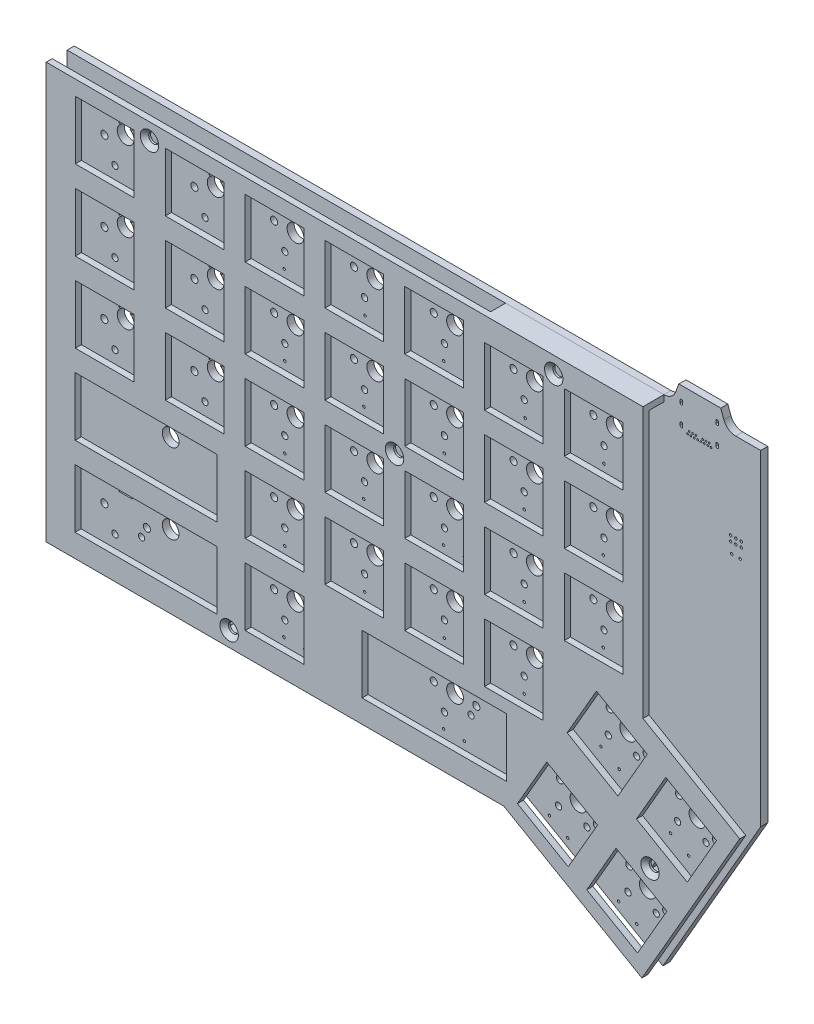
from build123d import *

# Parameters (mm, degrees)
BOSS_EXTRUDE1_START                            = -1.69143934
BOSS_EXTRUDE1_OUTLINE_R                        = 0.2999994
BOSS_EXTRUDE1_OUTLINE_R_2                      = 0.7499985
BOSS_EXTRUDE1_OUTLINE_R_3                      = 0.850000024
BOSS_EXTRUDE1_OUTLINE_R_4                      = 2
BOSS_EXTRUDE1_OUTLINE_W                        = 3.200004578
BOSS_EXTRUDE1_OUTLINE_H                        = 2.799999237
BOSS_EXTRUDE1_OUTLINE_W_2                      = 3.199996948
BOSS_EXTRUDE1_OUTLINE_H_2                      = 2.800003052
BOSS_EXTRUDE1_OUTLINE_W_3                      = 3.200000763
BOSS_EXTRUDE1_OUTLINE_W_4                      = 3.199999809
BOSS_EXTRUDE1_OUTLINE_H_3                      = 2.799995422
BOSS_EXTRUDE1_OUTLINE_R_5                      = 0.1999996
BOSS_EXTRUDE1_DEPTH                            = 1.69143934
SKETCH2_W                                      = 14
SKETCH2_H                                      = 14
BOSS_EXTRUDE2_DEPTH                            = 5.0038
CUT_EXTRUDE1_DEPTH                             = 3.556
SKETCH14_W                                     = 104.647420515
SKETCH14_H                                     = 1.5
SKETCH14_W_2                                   = 40.77646525
CUT_EXTRUDE6_DEPTH                             = 3.556
CSK_FOR_M2_FLAT_HEAD_MACHINE_SCREW1_AT_2_COUNT = 2
CSK_FOR_M2_FLAT_HEAD_MACHINE_SCREW1_AT_2_PITCH = 96.499998959
CSK_FOR_M2_FLAT_HEAD_MACHINE_SCREW1_AT_3_COUNT = 2
CSK_FOR_M2_FLAT_HEAD_MACHINE_SCREW1_AT_3_PITCH = 150.052698859
CSK_FOR_M2_FLAT_HEAD_MACHINE_SCREW1_AT_4_COUNT = 2
CSK_FOR_M2_FLAT_HEAD_MACHINE_SCREW1_AT_4_PITCH = 68.42879411
CSK_FOR_M2_FLAT_HEAD_MACHINE_SCREW1_AT_5_COUNT = 2
CSK_FOR_M2_FLAT_HEAD_MACHINE_SCREW1_AT_5_PITCH = 93.694270215


# Read off the part's stored shape, not the designer's step: Boss-Extrude1
with BuildPart() as part:
    # Boss-Extrude1 outline → Boss-Extrude1 (new body)
    with BuildSketch(Plane(origin=(0, 0, -1.69143934), x_dir=(-1, 0, 0), z_dir=(0, 0, -1)).offset(BOSS_EXTRUDE1_START)):
        with BuildLine():
            Line((-105.828579714, 28.936268203), (3.414418806, 28.936268203))
            Line((3.414418806, 28.936268203), (3.414418806, 128.136993408))
            Line((3.414418806, 128.136993408), (-139.057665021, 128.136993408))
            ThreePointArc((-139.057665021, 128.136993408), (-140.77192707, 128.675652414), (-141.869995117, 130.098007665))
            Line((-141.869995117, 130.098007665), (-142.623001099, 132.136993871))
            Line((-142.623001099, 132.136993871), (-152.623001099, 132.136993871))
            Line((-152.623001099, 132.136993871), (-153.37600708, 130.098007665))
            ThreePointArc((-153.37600708, 130.098007665), (-154.474075127, 128.675652414), (-156.188337176, 128.136993408))
            Line((-156.188337176, 128.136993408), (-162.162994385, 128.136993408))
            Line((-162.162994385, 128.136993408), (-162.162994385, 50.337001801))
            Line((-162.162994385, 50.337001801), (-138.81300354, 9.892999649))
            Line((-138.81300354, 9.892999649), (-105.828579714, 28.936268203))
        make_face()
        with Locations((-132.5650892, 15.4500072)):
            Circle(BOSS_EXTRUDE1_OUTLINE_R, mode=Mode.SUBTRACT)
        with Locations((-137.2306628, 19.99615)):
            Circle(BOSS_EXTRUDE1_OUTLINE_R_2, mode=Mode.SUBTRACT)
        with Locations((-139.600997925, 21.561000824)):
            Circle(BOSS_EXTRUDE1_OUTLINE_R_3, mode=Mode.SUBTRACT)
        with Locations((-135.201004028, 24.100999832)):
            Circle(BOSS_EXTRUDE1_OUTLINE_R_4, mode=Mode.SUBTRACT)
        with Locations((-128.234948, 17.9499768)):
            Circle(BOSS_EXTRUDE1_OUTLINE_R, mode=Mode.SUBTRACT)
        with Locations((-130.4614104, 20.9714592)):
            Circle(BOSS_EXTRUDE1_OUTLINE_R_2, mode=Mode.SUBTRACT)
        with Locations((-144.9650644, 35.749992)):
            Circle(BOSS_EXTRUDE1_OUTLINE_R, mode=Mode.SUBTRACT)
        Polygon((-137.315002441, 30.962999344), (-135.91521916, 28.537869719), (-138.687222333, 26.937871245), (-140.087005615, 29.36300087), align=None, mode=Mode.SUBTRACT)
        with Locations((-130.802001953, 26.641000748)):
            Circle(BOSS_EXTRUDE1_OUTLINE_R_3, mode=Mode.SUBTRACT)
        with Locations((-123.050003052, 31.108999252)):
            Circle(BOSS_EXTRUDE1_OUTLINE_R_3, mode=Mode.SUBTRACT)
        with Locations((-140.6349232, 38.2500124)):
            Circle(BOSS_EXTRUDE1_OUTLINE_R, mode=Mode.SUBTRACT)
        Polygon((-120.76499939, 40.511001587), (-119.364835204, 38.086092449), (-122.135838927, 36.48609016), (-123.536003113, 38.910999298), align=None, mode=Mode.SUBTRACT)
        with Locations((-116.065046, 24.9500136)):
            Circle(BOSS_EXTRUDE1_OUTLINE_R, mode=Mode.SUBTRACT)
        with Locations((-111.7349556, 27.4499832)):
            Circle(BOSS_EXTRUDE1_OUTLINE_R, mode=Mode.SUBTRACT)
        with Locations((-120.6798196, 29.5438576)):
            Circle(BOSS_EXTRUDE1_OUTLINE_R_2, mode=Mode.SUBTRACT)
        with Locations((-113.9105672, 30.5191668)):
            Circle(BOSS_EXTRUDE1_OUTLINE_R_2, mode=Mode.SUBTRACT)
        with Locations((-118.650001526, 33.64899826)):
            Circle(BOSS_EXTRUDE1_OUTLINE_R_4, mode=Mode.SUBTRACT)
        with Locations((-114.250999451, 36.188999176)):
            Circle(BOSS_EXTRUDE1_OUTLINE_R_3, mode=Mode.SUBTRACT)
        with Locations((-91.4347676, 32.7000108)):
            Circle(BOSS_EXTRUDE1_OUTLINE_R, mode=Mode.SUBTRACT)
        with Locations((-86.4347776, 32.7000108)):
            Circle(BOSS_EXTRUDE1_OUTLINE_R, mode=Mode.SUBTRACT)
        with Locations((-92.9947848, 38.8345172)):
            Circle(BOSS_EXTRUDE1_OUTLINE_R_2, mode=Mode.SUBTRACT)
        with Locations((-86.6447848, 36.2945172)):
            Circle(BOSS_EXTRUDE1_OUTLINE_R_2, mode=Mode.SUBTRACT)
        with Locations((-151.464996338, 42.130001068)):
            Circle(BOSS_EXTRUDE1_OUTLINE_R_3, mode=Mode.SUBTRACT)
        with Locations((-149.095206, 40.5649684)):
            Circle(BOSS_EXTRUDE1_OUTLINE_R_2, mode=Mode.SUBTRACT)
        with Locations((-142.3259536, 41.5402776)):
            Circle(BOSS_EXTRUDE1_OUTLINE_R_2, mode=Mode.SUBTRACT)
        with Locations((-147.065994263, 44.669998169)):
            Circle(BOSS_EXTRUDE1_OUTLINE_R_4, mode=Mode.SUBTRACT)
        with Locations((-142.666000366, 47.209999084)):
            Circle(BOSS_EXTRUDE1_OUTLINE_R_3, mode=Mode.SUBTRACT)
        Polygon((-149.179992676, 51.532001495), (-147.779833289, 49.107093991), (-150.550831546, 47.507099264), (-151.950990933, 49.932006768), align=None, mode=Mode.SUBTRACT)
        with Locations((-128.3650468, 45.3500236)):
            Circle(BOSS_EXTRUDE1_OUTLINE_R, mode=Mode.SUBTRACT)
        with Locations((-124.0349564, 47.8499932)):
            Circle(BOSS_EXTRUDE1_OUTLINE_R, mode=Mode.SUBTRACT)
        with Locations((-134.914001465, 51.678001404)):
            Circle(BOSS_EXTRUDE1_OUTLINE_R_3, mode=Mode.SUBTRACT)
        with Locations((-132.5443628, 50.11293)):
            Circle(BOSS_EXTRUDE1_OUTLINE_R_2, mode=Mode.SUBTRACT)
        with Locations((-125.7750596, 51.0882392)):
            Circle(BOSS_EXTRUDE1_OUTLINE_R_2, mode=Mode.SUBTRACT)
        with Locations((-130.51499939, 54.217998505)):
            Circle(BOSS_EXTRUDE1_OUTLINE_R_4, mode=Mode.SUBTRACT)
        Polygon((-132.628997803, 61.080001831), (-131.228832634, 58.655097666), (-133.999828727, 57.055095377), (-135.399993896, 59.479999542), align=None, mode=Mode.SUBTRACT)
        with Locations((-126.114997864, 56.75799942)):
            Circle(BOSS_EXTRUDE1_OUTLINE_R_3, mode=Mode.SUBTRACT)
        with Locations((-129.5827228, 68.6000152)):
            Circle(BOSS_EXTRUDE1_OUTLINE_R, mode=Mode.SUBTRACT)
        with Locations((-124.582682, 68.6000152)):
            Circle(BOSS_EXTRUDE1_OUTLINE_R, mode=Mode.SUBTRACT)
        with Locations((-110.7000072, 49.6000024)):
            Circle(BOSS_EXTRUDE1_OUTLINE_R, mode=Mode.SUBTRACT)
        with Locations((-105.7000172, 49.6000024)):
            Circle(BOSS_EXTRUDE1_OUTLINE_R, mode=Mode.SUBTRACT)
        with Locations((-105.6947848, 53.2750268)):
            Circle(BOSS_EXTRUDE1_OUTLINE_R_2, mode=Mode.SUBTRACT)
        with Locations((-94.26499939, 41.375)):
            Circle(BOSS_EXTRUDE1_OUTLINE_R_3, mode=Mode.SUBTRACT)
        with Locations((-89.184997559, 41.375)):
            Circle(BOSS_EXTRUDE1_OUTLINE_R_4, mode=Mode.SUBTRACT)
        with Locations((-84.105003357, 41.375)):
            Circle(BOSS_EXTRUDE1_OUTLINE_R_3, mode=Mode.SUBTRACT)
        with Locations((-89.185001373, 46.975000382)):
            Rectangle(BOSS_EXTRUDE1_OUTLINE_W, BOSS_EXTRUDE1_OUTLINE_H, mode=Mode.SUBTRACT)
        with Locations((-91.6447748, 51.5999984)):
            Circle(BOSS_EXTRUDE1_OUTLINE_R, mode=Mode.SUBTRACT)
        with Locations((-86.6447848, 51.5999984)):
            Circle(BOSS_EXTRUDE1_OUTLINE_R, mode=Mode.SUBTRACT)
        with Locations((-86.6447848, 55.3445172)):
            Circle(BOSS_EXTRUDE1_OUTLINE_R_2, mode=Mode.SUBTRACT)
        with Locations((-112.0447848, 55.8150268)):
            Circle(BOSS_EXTRUDE1_OUTLINE_R_2, mode=Mode.SUBTRACT)
        with Locations((-113.315002441, 58.354999542)):
            Circle(BOSS_EXTRUDE1_OUTLINE_R_3, mode=Mode.SUBTRACT)
        with Locations((-108.23500061, 58.354999542)):
            Circle(BOSS_EXTRUDE1_OUTLINE_R_4, mode=Mode.SUBTRACT)
        with Locations((-103.154998779, 58.354999542)):
            Circle(BOSS_EXTRUDE1_OUTLINE_R_3, mode=Mode.SUBTRACT)
        with Locations((-110.7000072, 68.6000152)):
            Circle(BOSS_EXTRUDE1_OUTLINE_R, mode=Mode.SUBTRACT)
        with Locations((-108.23500061, 63.955001831)):
            Rectangle(BOSS_EXTRUDE1_OUTLINE_W_2, BOSS_EXTRUDE1_OUTLINE_H_2, mode=Mode.SUBTRACT)
        with Locations((-105.7000172, 68.6000152)):
            Circle(BOSS_EXTRUDE1_OUTLINE_R, mode=Mode.SUBTRACT)
        with Locations((-92.9947848, 57.8845172)):
            Circle(BOSS_EXTRUDE1_OUTLINE_R_2, mode=Mode.SUBTRACT)
        with Locations((-94.26499939, 60.424999237)):
            Circle(BOSS_EXTRUDE1_OUTLINE_R_3, mode=Mode.SUBTRACT)
        with Locations((-89.184997559, 60.424999237)):
            Circle(BOSS_EXTRUDE1_OUTLINE_R_4, mode=Mode.SUBTRACT)
        with Locations((-84.105003357, 60.424999237)):
            Circle(BOSS_EXTRUDE1_OUTLINE_R_3, mode=Mode.SUBTRACT)
        with Locations((-91.4347676, 70.6999856)):
            Circle(BOSS_EXTRUDE1_OUTLINE_R, mode=Mode.SUBTRACT)
        with Locations((-89.185001373, 66.025001526)):
            Rectangle(BOSS_EXTRUDE1_OUTLINE_W, BOSS_EXTRUDE1_OUTLINE_H_2, mode=Mode.SUBTRACT)
        with Locations((-86.4347776, 70.6999856)):
            Circle(BOSS_EXTRUDE1_OUTLINE_R, mode=Mode.SUBTRACT)
        with Locations((-53.3347676, 32.5999856)):
            Circle(BOSS_EXTRUDE1_OUTLINE_R, mode=Mode.SUBTRACT)
        with Locations((-48.3347776, 32.5999856)):
            Circle(BOSS_EXTRUDE1_OUTLINE_R, mode=Mode.SUBTRACT)
        with Locations((-48.5447848, 36.2945172)):
            Circle(BOSS_EXTRUDE1_OUTLINE_R_2, mode=Mode.SUBTRACT)
        with Locations((-54.8947848, 38.8345172)):
            Circle(BOSS_EXTRUDE1_OUTLINE_R_2, mode=Mode.SUBTRACT)
        with Locations((-34.2847676, 30.100016)):
            Circle(BOSS_EXTRUDE1_OUTLINE_R, mode=Mode.SUBTRACT)
        with Locations((-29.2847776, 30.100016)):
            Circle(BOSS_EXTRUDE1_OUTLINE_R, mode=Mode.SUBTRACT)
        with Locations((-12.9947924, 30.100016)):
            Circle(BOSS_EXTRUDE1_OUTLINE_R, mode=Mode.SUBTRACT)
        with Locations((-7.9948024, 30.100016)):
            Circle(BOSS_EXTRUDE1_OUTLINE_R, mode=Mode.SUBTRACT)
        with Locations((-14.3448024, 36.3265212)):
            Circle(BOSS_EXTRUDE1_OUTLINE_R_2, mode=Mode.SUBTRACT)
        with Locations((-7.9948024, 33.7865212)):
            Circle(BOSS_EXTRUDE1_OUTLINE_R_2, mode=Mode.SUBTRACT)
        with Locations((-15.614999771, 38.86700058)):
            Circle(BOSS_EXTRUDE1_OUTLINE_R_3, mode=Mode.SUBTRACT)
        with Locations((-5.454999924, 38.86700058)):
            Circle(BOSS_EXTRUDE1_OUTLINE_R_3, mode=Mode.SUBTRACT)
        with Locations((-72.5947748, 51.5999984)):
            Circle(BOSS_EXTRUDE1_OUTLINE_R, mode=Mode.SUBTRACT)
        with Locations((-67.5947848, 51.5999984)):
            Circle(BOSS_EXTRUDE1_OUTLINE_R, mode=Mode.SUBTRACT)
        with Locations((-67.5947848, 55.3445172)):
            Circle(BOSS_EXTRUDE1_OUTLINE_R_2, mode=Mode.SUBTRACT)
        with Locations((-56.165000916, 41.375)):
            Circle(BOSS_EXTRUDE1_OUTLINE_R_3, mode=Mode.SUBTRACT)
        with Locations((-51.084999084, 41.375)):
            Circle(BOSS_EXTRUDE1_OUTLINE_R_4, mode=Mode.SUBTRACT)
        with Locations((-51.085000992, 46.975000382)):
            Rectangle(BOSS_EXTRUDE1_OUTLINE_W_3, BOSS_EXTRUDE1_OUTLINE_H, mode=Mode.SUBTRACT)
        with Locations((-46.005001068, 41.375)):
            Circle(BOSS_EXTRUDE1_OUTLINE_R_3, mode=Mode.SUBTRACT)
        with Locations((-53.542692, 51.5999984)):
            Circle(BOSS_EXTRUDE1_OUTLINE_R, mode=Mode.SUBTRACT)
        with Locations((-48.542702, 51.5999984)):
            Circle(BOSS_EXTRUDE1_OUTLINE_R, mode=Mode.SUBTRACT)
        with Locations((-48.5447848, 55.3445172)):
            Circle(BOSS_EXTRUDE1_OUTLINE_R_2, mode=Mode.SUBTRACT)
        with Locations((-73.9447848, 57.8845172)):
            Circle(BOSS_EXTRUDE1_OUTLINE_R_2, mode=Mode.SUBTRACT)
        with Locations((-75.214996338, 60.424999237)):
            Circle(BOSS_EXTRUDE1_OUTLINE_R_3, mode=Mode.SUBTRACT)
        with Locations((-70.135002136, 60.424999237)):
            Circle(BOSS_EXTRUDE1_OUTLINE_R_4, mode=Mode.SUBTRACT)
        with Locations((-65.055000305, 60.424999237)):
            Circle(BOSS_EXTRUDE1_OUTLINE_R_3, mode=Mode.SUBTRACT)
        with Locations((-70.135002136, 66.025001526)):
            Rectangle(BOSS_EXTRUDE1_OUTLINE_W_2, BOSS_EXTRUDE1_OUTLINE_H_2, mode=Mode.SUBTRACT)
        with Locations((-72.3847676, 70.6999856)):
            Circle(BOSS_EXTRUDE1_OUTLINE_R, mode=Mode.SUBTRACT)
        with Locations((-67.3847776, 70.6999856)):
            Circle(BOSS_EXTRUDE1_OUTLINE_R, mode=Mode.SUBTRACT)
        with Locations((-54.8947848, 57.8845172)):
            Circle(BOSS_EXTRUDE1_OUTLINE_R_2, mode=Mode.SUBTRACT)
        with Locations((-56.165000916, 60.424999237)):
            Circle(BOSS_EXTRUDE1_OUTLINE_R_3, mode=Mode.SUBTRACT)
        with Locations((-51.084999084, 60.424999237)):
            Circle(BOSS_EXTRUDE1_OUTLINE_R_4, mode=Mode.SUBTRACT)
        with Locations((-46.005001068, 60.424999237)):
            Circle(BOSS_EXTRUDE1_OUTLINE_R_3, mode=Mode.SUBTRACT)
        with Locations((-51.085000992, 66.025001526)):
            Rectangle(BOSS_EXTRUDE1_OUTLINE_W_3, BOSS_EXTRUDE1_OUTLINE_H_2, mode=Mode.SUBTRACT)
        with Locations((-53.542692, 70.6999856)):
            Circle(BOSS_EXTRUDE1_OUTLINE_R, mode=Mode.SUBTRACT)
        with Locations((-48.542702, 70.6999856)):
            Circle(BOSS_EXTRUDE1_OUTLINE_R, mode=Mode.SUBTRACT)
        with Locations((-21.284999847, 41.375)):
            Circle(BOSS_EXTRUDE1_OUTLINE_R_4, mode=Mode.SUBTRACT)
        with Locations((-34.4947748, 49.2000032)):
            Circle(BOSS_EXTRUDE1_OUTLINE_R, mode=Mode.SUBTRACT)
        with Locations((-29.4947848, 49.2000032)):
            Circle(BOSS_EXTRUDE1_OUTLINE_R, mode=Mode.SUBTRACT)
        with Locations((-10.535000325, 44.467000962)):
            Rectangle(BOSS_EXTRUDE1_OUTLINE_W_4, BOSS_EXTRUDE1_OUTLINE_H, mode=Mode.SUBTRACT)
        with Locations((-12.9947924, 49.2000032)):
            Circle(BOSS_EXTRUDE1_OUTLINE_R, mode=Mode.SUBTRACT)
        with Locations((-7.9948024, 49.2000032)):
            Circle(BOSS_EXTRUDE1_OUTLINE_R, mode=Mode.SUBTRACT)
        with Locations((-21.284999847, 60.424999237)):
            Circle(BOSS_EXTRUDE1_OUTLINE_R_4, mode=Mode.SUBTRACT)
        with Locations((-34.4947748, 68.200016)):
            Circle(BOSS_EXTRUDE1_OUTLINE_R, mode=Mode.SUBTRACT)
        with Locations((-29.4947848, 68.200016)):
            Circle(BOSS_EXTRUDE1_OUTLINE_R, mode=Mode.SUBTRACT)
        with Locations((-12.7847852, 68.200016)):
            Circle(BOSS_EXTRUDE1_OUTLINE_R, mode=Mode.SUBTRACT)
        with Locations((-7.7847952, 68.200016)):
            Circle(BOSS_EXTRUDE1_OUTLINE_R, mode=Mode.SUBTRACT)
        with Locations((-132.365005493, 77.404998779)):
            Circle(BOSS_EXTRUDE1_OUTLINE_R_3, mode=Mode.SUBTRACT)
        with Locations((-124.7447848, 72.3250268)):
            Circle(BOSS_EXTRUDE1_OUTLINE_R_2, mode=Mode.SUBTRACT)
        with Locations((-131.0947848, 74.8650268)):
            Circle(BOSS_EXTRUDE1_OUTLINE_R_2, mode=Mode.SUBTRACT)
        with Locations((-127.285003662, 77.404998779)):
            Circle(BOSS_EXTRUDE1_OUTLINE_R_4, mode=Mode.SUBTRACT)
        with Locations((-122.205001831, 77.404998779)):
            Circle(BOSS_EXTRUDE1_OUTLINE_R_3, mode=Mode.SUBTRACT)
        with Locations((-127.284996033, 83.005001068)):
            Rectangle(BOSS_EXTRUDE1_OUTLINE_W_2, BOSS_EXTRUDE1_OUTLINE_H_3, mode=Mode.SUBTRACT)
        with Locations((-129.5827228, 87.7000024)):
            Circle(BOSS_EXTRUDE1_OUTLINE_R, mode=Mode.SUBTRACT)
        with Locations((-124.582682, 87.7000024)):
            Circle(BOSS_EXTRUDE1_OUTLINE_R, mode=Mode.SUBTRACT)
        with Locations((-131.092702, 93.9152808)):
            Circle(BOSS_EXTRUDE1_OUTLINE_R_2, mode=Mode.SUBTRACT)
        with Locations((-124.742702, 91.3752808)):
            Circle(BOSS_EXTRUDE1_OUTLINE_R_2, mode=Mode.SUBTRACT)
        with Locations((-132.363006592, 96.455001831)):
            Circle(BOSS_EXTRUDE1_OUTLINE_R_3, mode=Mode.SUBTRACT)
        with Locations((-127.282997131, 96.455001831)):
            Circle(BOSS_EXTRUDE1_OUTLINE_R_4, mode=Mode.SUBTRACT)
        with Locations((-122.20300293, 96.455001831)):
            Circle(BOSS_EXTRUDE1_OUTLINE_R_3, mode=Mode.SUBTRACT)
        with Locations((-112.0447848, 74.8650268)):
            Circle(BOSS_EXTRUDE1_OUTLINE_R_2, mode=Mode.SUBTRACT)
        with Locations((-113.315002441, 77.404998779)):
            Circle(BOSS_EXTRUDE1_OUTLINE_R_3, mode=Mode.SUBTRACT)
        with Locations((-105.6947848, 72.3250268)):
            Circle(BOSS_EXTRUDE1_OUTLINE_R_2, mode=Mode.SUBTRACT)
        with Locations((-108.23500061, 77.404998779)):
            Circle(BOSS_EXTRUDE1_OUTLINE_R_4, mode=Mode.SUBTRACT)
        with Locations((-103.154998779, 77.404998779)):
            Circle(BOSS_EXTRUDE1_OUTLINE_R_3, mode=Mode.SUBTRACT)
        with Locations((-108.23500061, 83.005001068)):
            Rectangle(BOSS_EXTRUDE1_OUTLINE_W_2, BOSS_EXTRUDE1_OUTLINE_H_3, mode=Mode.SUBTRACT)
        with Locations((-92.9947848, 76.9345172)):
            Circle(BOSS_EXTRUDE1_OUTLINE_R_2, mode=Mode.SUBTRACT)
        with Locations((-86.6447848, 74.3945172)):
            Circle(BOSS_EXTRUDE1_OUTLINE_R_2, mode=Mode.SUBTRACT)
        with Locations((-94.26499939, 79.474998474)):
            Circle(BOSS_EXTRUDE1_OUTLINE_R_3, mode=Mode.SUBTRACT)
        with Locations((-89.184997559, 79.474998474)):
            Circle(BOSS_EXTRUDE1_OUTLINE_R_4, mode=Mode.SUBTRACT)
        with Locations((-84.105003357, 79.474998474)):
            Circle(BOSS_EXTRUDE1_OUTLINE_R_3, mode=Mode.SUBTRACT)
        with Locations((-89.185001373, 85.075000763)):
            Rectangle(BOSS_EXTRUDE1_OUTLINE_W, BOSS_EXTRUDE1_OUTLINE_H_3, mode=Mode.SUBTRACT)
        with Locations((-110.7000072, 87.7000024)):
            Circle(BOSS_EXTRUDE1_OUTLINE_R, mode=Mode.SUBTRACT)
        with Locations((-112.042702, 93.9152808)):
            Circle(BOSS_EXTRUDE1_OUTLINE_R_2, mode=Mode.SUBTRACT)
        with Locations((-105.7000172, 87.7000024)):
            Circle(BOSS_EXTRUDE1_OUTLINE_R, mode=Mode.SUBTRACT)
        with Locations((-105.692702, 91.3752808)):
            Circle(BOSS_EXTRUDE1_OUTLINE_R_2, mode=Mode.SUBTRACT)
        with Locations((-113.31300354, 96.455001831)):
            Circle(BOSS_EXTRUDE1_OUTLINE_R_3, mode=Mode.SUBTRACT)
        with Locations((-108.233001709, 96.455001831)):
            Circle(BOSS_EXTRUDE1_OUTLINE_R_4, mode=Mode.SUBTRACT)
        with Locations((-103.152999878, 96.455001831)):
            Circle(BOSS_EXTRUDE1_OUTLINE_R_3, mode=Mode.SUBTRACT)
        with Locations((-91.642692, 89.8000236)):
            Circle(BOSS_EXTRUDE1_OUTLINE_R, mode=Mode.SUBTRACT)
        with Locations((-86.642702, 89.8000236)):
            Circle(BOSS_EXTRUDE1_OUTLINE_R, mode=Mode.SUBTRACT)
        with Locations((-86.6447848, 93.4445172)):
            Circle(BOSS_EXTRUDE1_OUTLINE_R_2, mode=Mode.SUBTRACT)
        with Locations((-92.9947848, 95.9845172)):
            Circle(BOSS_EXTRUDE1_OUTLINE_R_2, mode=Mode.SUBTRACT)
        with Locations((-94.26499939, 98.525001526)):
            Circle(BOSS_EXTRUDE1_OUTLINE_R_3, mode=Mode.SUBTRACT)
        with Locations((-89.184997559, 98.525001526)):
            Circle(BOSS_EXTRUDE1_OUTLINE_R_4, mode=Mode.SUBTRACT)
        with Locations((-84.105003357, 98.525001526)):
            Circle(BOSS_EXTRUDE1_OUTLINE_R_3, mode=Mode.SUBTRACT)
        with Locations((-157.2500284, 103.249984)):
            Circle(BOSS_EXTRUDE1_OUTLINE_R, mode=Mode.SUBTRACT)
        with Locations((-155.2500324, 103.249984)):
            Circle(BOSS_EXTRUDE1_OUTLINE_R, mode=Mode.SUBTRACT)
        with Locations((-157.5000152, 105.7299892)):
            Circle(BOSS_EXTRUDE1_OUTLINE_R, mode=Mode.SUBTRACT)
        with Locations((-157.5000152, 106.9999892)):
            Circle(BOSS_EXTRUDE1_OUTLINE_R, mode=Mode.SUBTRACT)
        with Locations((-156.2300152, 105.7299892)):
            Circle(BOSS_EXTRUDE1_OUTLINE_R, mode=Mode.SUBTRACT)
        with Locations((-154.9600152, 105.7299892)):
            Circle(BOSS_EXTRUDE1_OUTLINE_R, mode=Mode.SUBTRACT)
        with Locations((-156.2300152, 106.9999892)):
            Circle(BOSS_EXTRUDE1_OUTLINE_R, mode=Mode.SUBTRACT)
        with Locations((-154.9600152, 106.9999892)):
            Circle(BOSS_EXTRUDE1_OUTLINE_R, mode=Mode.SUBTRACT)
        with Locations((-127.282997131, 102.055000305)):
            Rectangle(BOSS_EXTRUDE1_OUTLINE_W_2, BOSS_EXTRUDE1_OUTLINE_H_2, mode=Mode.SUBTRACT)
        with Locations((-129.742692, 106.7000152)):
            Circle(BOSS_EXTRUDE1_OUTLINE_R, mode=Mode.SUBTRACT)
        with Locations((-124.742702, 106.7000152)):
            Circle(BOSS_EXTRUDE1_OUTLINE_R, mode=Mode.SUBTRACT)
        with Locations((-132.363006592, 115.504997253)):
            Circle(BOSS_EXTRUDE1_OUTLINE_R_3, mode=Mode.SUBTRACT)
        with Locations((-131.092702, 112.9652808)):
            Circle(BOSS_EXTRUDE1_OUTLINE_R_2, mode=Mode.SUBTRACT)
        with Locations((-124.742702, 110.4252808)):
            Circle(BOSS_EXTRUDE1_OUTLINE_R_2, mode=Mode.SUBTRACT)
        with Locations((-127.282997131, 115.504997253)):
            Circle(BOSS_EXTRUDE1_OUTLINE_R_4, mode=Mode.SUBTRACT)
        with Locations((-122.20300293, 115.504997253)):
            Circle(BOSS_EXTRUDE1_OUTLINE_R_3, mode=Mode.SUBTRACT)
        with Locations((-150.2999788, 122.8200236)):
            Circle(BOSS_EXTRUDE1_OUTLINE_R_5, mode=Mode.SUBTRACT)
        with Locations((-149.4999804, 122.8200236)):
            Circle(BOSS_EXTRUDE1_OUTLINE_R_5, mode=Mode.SUBTRACT)
        with Locations((-149.8999796, 123.5199968)):
            Circle(BOSS_EXTRUDE1_OUTLINE_R_5, mode=Mode.SUBTRACT)
        with BuildLine():
            ThreePointArc((-151.469979, 123.6699838), (-151.7699784, 123.3699844), (-152.0699778, 123.6699838))
            Line((-152.0699778, 123.6699838), (-152.0699778, 124.2699826))
            ThreePointArc((-152.0699778, 124.2699826), (-151.7699784, 124.569982), (-151.469979, 124.2699826))
            Line((-151.469979, 124.2699826), (-151.469979, 123.6699838))
        make_face(mode=Mode.SUBTRACT)
        with Locations((-148.699982, 122.8200236)):
            Circle(BOSS_EXTRUDE1_OUTLINE_R_5, mode=Mode.SUBTRACT)
        with Locations((-149.0999812, 123.5199968)):
            Circle(BOSS_EXTRUDE1_OUTLINE_R_5, mode=Mode.SUBTRACT)
        with Locations((-148.2999828, 123.5199968)):
            Circle(BOSS_EXTRUDE1_OUTLINE_R_5, mode=Mode.SUBTRACT)
        with Locations((-147.8999836, 122.8200236)):
            Circle(BOSS_EXTRUDE1_OUTLINE_R_5, mode=Mode.SUBTRACT)
        with Locations((-147.0999852, 122.8200236)):
            Circle(BOSS_EXTRUDE1_OUTLINE_R_5, mode=Mode.SUBTRACT)
        with Locations((-146.699986, 123.5199968)):
            Circle(BOSS_EXTRUDE1_OUTLINE_R_5, mode=Mode.SUBTRACT)
        with Locations((-146.2999868, 122.8200236)):
            Circle(BOSS_EXTRUDE1_OUTLINE_R_5, mode=Mode.SUBTRACT)
        with Locations((-145.4999884, 122.8200236)):
            Circle(BOSS_EXTRUDE1_OUTLINE_R_5, mode=Mode.SUBTRACT)
        with Locations((-145.8999876, 123.5199968)):
            Circle(BOSS_EXTRUDE1_OUTLINE_R_5, mode=Mode.SUBTRACT)
        with Locations((-144.69999, 122.8200236)):
            Circle(BOSS_EXTRUDE1_OUTLINE_R_5, mode=Mode.SUBTRACT)
        with Locations((-145.0999892, 123.5199968)):
            Circle(BOSS_EXTRUDE1_OUTLINE_R_5, mode=Mode.SUBTRACT)
        with BuildLine():
            ThreePointArc((-142.929991, 123.6699838), (-143.2299904, 123.3699844), (-143.5299898, 123.6699838))
            Line((-143.5299898, 123.6699838), (-143.5299898, 124.2699826))
            ThreePointArc((-143.5299898, 124.2699826), (-143.2299904, 124.569982), (-142.929991, 124.2699826))
            Line((-142.929991, 124.2699826), (-142.929991, 123.6699838))
        make_face(mode=Mode.SUBTRACT)
        with BuildLine():
            ThreePointArc((-151.469979, 128.4000226), (-151.7699784, 128.1000232), (-152.0699778, 128.4000226))
            Line((-152.0699778, 128.4000226), (-152.0699778, 129.0000214))
            ThreePointArc((-152.0699778, 129.0000214), (-151.7699784, 129.3000208), (-151.469979, 129.0000214))
            Line((-151.469979, 129.0000214), (-151.469979, 128.4000226))
        make_face(mode=Mode.SUBTRACT)
        with BuildLine():
            ThreePointArc((-142.929991, 128.4000226), (-143.2299904, 128.1000232), (-143.5299898, 128.4000226))
            Line((-143.5299898, 128.4000226), (-143.5299898, 129.0000214))
            ThreePointArc((-143.5299898, 129.0000214), (-143.2299904, 129.3000208), (-142.929991, 129.0000214))
            Line((-142.929991, 129.0000214), (-142.929991, 128.4000226))
        make_face(mode=Mode.SUBTRACT)
        with Locations((-127.282997131, 121.104999542)):
            Rectangle(BOSS_EXTRUDE1_OUTLINE_W_2, BOSS_EXTRUDE1_OUTLINE_H_3, mode=Mode.SUBTRACT)
        with Locations((-110.932722, 106.7000152)):
            Circle(BOSS_EXTRUDE1_OUTLINE_R, mode=Mode.SUBTRACT)
        with Locations((-108.233001709, 102.055000305)):
            Rectangle(BOSS_EXTRUDE1_OUTLINE_W_2, BOSS_EXTRUDE1_OUTLINE_H_2, mode=Mode.SUBTRACT)
        with Locations((-105.9326812, 106.7000152)):
            Circle(BOSS_EXTRUDE1_OUTLINE_R, mode=Mode.SUBTRACT)
        with Locations((-112.042702, 112.9652808)):
            Circle(BOSS_EXTRUDE1_OUTLINE_R_2, mode=Mode.SUBTRACT)
        with Locations((-113.31300354, 115.504997253)):
            Circle(BOSS_EXTRUDE1_OUTLINE_R_3, mode=Mode.SUBTRACT)
        with Locations((-105.692702, 110.4252808)):
            Circle(BOSS_EXTRUDE1_OUTLINE_R_2, mode=Mode.SUBTRACT)
        with Locations((-108.233001709, 115.504997253)):
            Circle(BOSS_EXTRUDE1_OUTLINE_R_4, mode=Mode.SUBTRACT)
        with Locations((-103.152999878, 115.504997253)):
            Circle(BOSS_EXTRUDE1_OUTLINE_R_3, mode=Mode.SUBTRACT)
        with Locations((-91.4827228, 108.7999856)):
            Circle(BOSS_EXTRUDE1_OUTLINE_R, mode=Mode.SUBTRACT)
        with Locations((-89.185001373, 104.125)):
            Rectangle(BOSS_EXTRUDE1_OUTLINE_W, BOSS_EXTRUDE1_OUTLINE_H_2, mode=Mode.SUBTRACT)
        with Locations((-86.482682, 108.7999856)):
            Circle(BOSS_EXTRUDE1_OUTLINE_R, mode=Mode.SUBTRACT)
        with Locations((-92.992702, 115.0347712)):
            Circle(BOSS_EXTRUDE1_OUTLINE_R_2, mode=Mode.SUBTRACT)
        with Locations((-86.642702, 112.4947712)):
            Circle(BOSS_EXTRUDE1_OUTLINE_R_2, mode=Mode.SUBTRACT)
        with Locations((-108.233001709, 121.104999542)):
            Rectangle(BOSS_EXTRUDE1_OUTLINE_W_2, BOSS_EXTRUDE1_OUTLINE_H_3, mode=Mode.SUBTRACT)
        with Locations((-94.263000488, 117.574996948)):
            Circle(BOSS_EXTRUDE1_OUTLINE_R_3, mode=Mode.SUBTRACT)
        with Locations((-89.182998657, 117.574996948)):
            Circle(BOSS_EXTRUDE1_OUTLINE_R_4, mode=Mode.SUBTRACT)
        with Locations((-84.102996826, 117.574996948)):
            Circle(BOSS_EXTRUDE1_OUTLINE_R_3, mode=Mode.SUBTRACT)
        with Locations((-89.182998657, 123.174999237)):
            Rectangle(BOSS_EXTRUDE1_OUTLINE_W_2, BOSS_EXTRUDE1_OUTLINE_H_3, mode=Mode.SUBTRACT)
        with Locations((-73.9447848, 76.9345172)):
            Circle(BOSS_EXTRUDE1_OUTLINE_R_2, mode=Mode.SUBTRACT)
        with Locations((-67.5947848, 74.3945172)):
            Circle(BOSS_EXTRUDE1_OUTLINE_R_2, mode=Mode.SUBTRACT)
        with Locations((-75.214996338, 79.474998474)):
            Circle(BOSS_EXTRUDE1_OUTLINE_R_3, mode=Mode.SUBTRACT)
        with Locations((-70.135002136, 79.474998474)):
            Circle(BOSS_EXTRUDE1_OUTLINE_R_4, mode=Mode.SUBTRACT)
        with Locations((-70.135002136, 85.075000763)):
            Rectangle(BOSS_EXTRUDE1_OUTLINE_W_2, BOSS_EXTRUDE1_OUTLINE_H_3, mode=Mode.SUBTRACT)
        with Locations((-65.055000305, 79.474998474)):
            Circle(BOSS_EXTRUDE1_OUTLINE_R_3, mode=Mode.SUBTRACT)
        with Locations((-48.5447848, 74.3945172)):
            Circle(BOSS_EXTRUDE1_OUTLINE_R_2, mode=Mode.SUBTRACT)
        with Locations((-54.8947848, 76.9345172)):
            Circle(BOSS_EXTRUDE1_OUTLINE_R_2, mode=Mode.SUBTRACT)
        with Locations((-56.165000916, 79.474998474)):
            Circle(BOSS_EXTRUDE1_OUTLINE_R_3, mode=Mode.SUBTRACT)
        with Locations((-51.084999084, 79.474998474)):
            Circle(BOSS_EXTRUDE1_OUTLINE_R_4, mode=Mode.SUBTRACT)
        with Locations((-51.085000992, 85.075000763)):
            Rectangle(BOSS_EXTRUDE1_OUTLINE_W_3, BOSS_EXTRUDE1_OUTLINE_H_3, mode=Mode.SUBTRACT)
        with Locations((-46.005001068, 79.474998474)):
            Circle(BOSS_EXTRUDE1_OUTLINE_R_3, mode=Mode.SUBTRACT)
        with Locations((-72.4348056, 89.8000236)):
            Circle(BOSS_EXTRUDE1_OUTLINE_R, mode=Mode.SUBTRACT)
        with Locations((-67.4347648, 89.8000236)):
            Circle(BOSS_EXTRUDE1_OUTLINE_R, mode=Mode.SUBTRACT)
        with Locations((-67.5947848, 93.4445172)):
            Circle(BOSS_EXTRUDE1_OUTLINE_R_2, mode=Mode.SUBTRACT)
        with Locations((-73.9447848, 95.9845172)):
            Circle(BOSS_EXTRUDE1_OUTLINE_R_2, mode=Mode.SUBTRACT)
        with Locations((-75.214996338, 98.525001526)):
            Circle(BOSS_EXTRUDE1_OUTLINE_R_3, mode=Mode.SUBTRACT)
        with Locations((-70.135002136, 98.525001526)):
            Circle(BOSS_EXTRUDE1_OUTLINE_R_4, mode=Mode.SUBTRACT)
        with Locations((-65.055000305, 98.525001526)):
            Circle(BOSS_EXTRUDE1_OUTLINE_R_3, mode=Mode.SUBTRACT)
        with Locations((-53.542692, 89.8000236)):
            Circle(BOSS_EXTRUDE1_OUTLINE_R, mode=Mode.SUBTRACT)
        with Locations((-48.542702, 89.8000236)):
            Circle(BOSS_EXTRUDE1_OUTLINE_R, mode=Mode.SUBTRACT)
        with Locations((-48.5447848, 93.4445172)):
            Circle(BOSS_EXTRUDE1_OUTLINE_R_2, mode=Mode.SUBTRACT)
        with Locations((-54.8947848, 95.9845172)):
            Circle(BOSS_EXTRUDE1_OUTLINE_R_2, mode=Mode.SUBTRACT)
        with Locations((-56.165000916, 98.525001526)):
            Circle(BOSS_EXTRUDE1_OUTLINE_R_3, mode=Mode.SUBTRACT)
        with Locations((-51.084999084, 98.525001526)):
            Circle(BOSS_EXTRUDE1_OUTLINE_R_4, mode=Mode.SUBTRACT)
        with Locations((-46.005001068, 98.525001526)):
            Circle(BOSS_EXTRUDE1_OUTLINE_R_3, mode=Mode.SUBTRACT)
        with Locations((-35.8447848, 74.4265212)):
            Circle(BOSS_EXTRUDE1_OUTLINE_R_2, mode=Mode.SUBTRACT)
        with Locations((-29.4947848, 71.8865212)):
            Circle(BOSS_EXTRUDE1_OUTLINE_R_2, mode=Mode.SUBTRACT)
        with Locations((-37.115001678, 76.967002869)):
            Circle(BOSS_EXTRUDE1_OUTLINE_R_3, mode=Mode.SUBTRACT)
        with Locations((-26.954999924, 76.967002869)):
            Circle(BOSS_EXTRUDE1_OUTLINE_R_3, mode=Mode.SUBTRACT)
        with BuildLine():
            Line((-30.434999466, 81.166999817), (-30.968636187, 81.166999817))
            ThreePointArc((-30.968636187, 81.166999817), (-32.034999847, 77.474998474), (-33.101363508, 81.166999817))
            Line((-33.101363508, 81.166999817), (-33.634998322, 81.166999817))
            Line((-33.634998322, 81.166999817), (-33.634998322, 83.967002869))
            Line((-33.634998322, 83.967002869), (-30.434999466, 83.967002869))
            Line((-30.434999466, 83.967002869), (-30.434999466, 81.166999817))
        make_face(mode=Mode.SUBTRACT)
        with Locations((-14.3448024, 74.4265212)):
            Circle(BOSS_EXTRUDE1_OUTLINE_R_2, mode=Mode.SUBTRACT)
        with Locations((-7.9948024, 71.8865212)):
            Circle(BOSS_EXTRUDE1_OUTLINE_R_2, mode=Mode.SUBTRACT)
        with Locations((-15.614999771, 76.967002869)):
            Circle(BOSS_EXTRUDE1_OUTLINE_R_3, mode=Mode.SUBTRACT)
        with Locations((-5.454999924, 76.967002869)):
            Circle(BOSS_EXTRUDE1_OUTLINE_R_3, mode=Mode.SUBTRACT)
        with BuildLine():
            Line((-8.93500042, 81.166999817), (-9.468636187, 81.166999817))
            ThreePointArc((-9.468636187, 81.166999817), (-10.534999847, 77.474998474), (-11.601363508, 81.166999817))
            Line((-11.601363508, 81.166999817), (-12.135000229, 81.166999817))
            Line((-12.135000229, 81.166999817), (-12.135000229, 83.967002869))
            Line((-12.135000229, 83.967002869), (-8.93500042, 83.967002869))
            Line((-8.93500042, 83.967002869), (-8.93500042, 81.166999817))
        make_face(mode=Mode.SUBTRACT)
        with Locations((-34.4947748, 87.3000032)):
            Circle(BOSS_EXTRUDE1_OUTLINE_R, mode=Mode.SUBTRACT)
        with Locations((-29.4947848, 87.3000032)):
            Circle(BOSS_EXTRUDE1_OUTLINE_R, mode=Mode.SUBTRACT)
        with Locations((-35.8447848, 93.4765212)):
            Circle(BOSS_EXTRUDE1_OUTLINE_R_2, mode=Mode.SUBTRACT)
        with Locations((-29.4947848, 90.9365212)):
            Circle(BOSS_EXTRUDE1_OUTLINE_R_2, mode=Mode.SUBTRACT)
        with Locations((-37.115001678, 96.016998291)):
            Circle(BOSS_EXTRUDE1_OUTLINE_R_3, mode=Mode.SUBTRACT)
        with BuildLine():
            Line((-30.434999466, 100.217002869), (-30.968636187, 100.217002869))
            ThreePointArc((-30.968636187, 100.217002869), (-32.034999847, 96.525001526), (-33.101363508, 100.217002869))
            Line((-33.101363508, 100.217002869), (-33.634998322, 100.217002869))
            Line((-33.634998322, 100.217002869), (-33.634998322, 103.016998291))
            Line((-33.634998322, 103.016998291), (-30.434999466, 103.016998291))
            Line((-30.434999466, 103.016998291), (-30.434999466, 100.217002869))
        make_face(mode=Mode.SUBTRACT)
        with Locations((-26.954999924, 96.016998291)):
            Circle(BOSS_EXTRUDE1_OUTLINE_R_3, mode=Mode.SUBTRACT)
        with Locations((-12.8347724, 87.3000032)):
            Circle(BOSS_EXTRUDE1_OUTLINE_R, mode=Mode.SUBTRACT)
        with Locations((-7.8347824, 87.3000032)):
            Circle(BOSS_EXTRUDE1_OUTLINE_R, mode=Mode.SUBTRACT)
        with Locations((-14.3448024, 93.4765212)):
            Circle(BOSS_EXTRUDE1_OUTLINE_R_2, mode=Mode.SUBTRACT)
        with Locations((-7.9948024, 90.9365212)):
            Circle(BOSS_EXTRUDE1_OUTLINE_R_2, mode=Mode.SUBTRACT)
        with Locations((-15.614999771, 96.016998291)):
            Circle(BOSS_EXTRUDE1_OUTLINE_R_3, mode=Mode.SUBTRACT)
        with BuildLine():
            ThreePointArc((-9.468636187, 100.217002869), (-10.534999847, 96.525001526), (-11.601363508, 100.217002869))
            Line((-11.601363508, 100.217002869), (-12.135000229, 100.217002869))
            Line((-12.135000229, 100.217002869), (-12.135000229, 103.016998291))
            Line((-12.135000229, 103.016998291), (-8.93500042, 103.016998291))
            Line((-8.93500042, 103.016998291), (-8.93500042, 100.217002869))
            Line((-8.93500042, 100.217002869), (-9.468636187, 100.217002869))
        make_face(mode=Mode.SUBTRACT)
        with Locations((-5.454999924, 96.016998291)):
            Circle(BOSS_EXTRUDE1_OUTLINE_R_3, mode=Mode.SUBTRACT)
        with Locations((-70.135002136, 104.125)):
            Rectangle(BOSS_EXTRUDE1_OUTLINE_W_2, BOSS_EXTRUDE1_OUTLINE_H_2, mode=Mode.SUBTRACT)
        with Locations((-72.6999816, 108.7999856)):
            Circle(BOSS_EXTRUDE1_OUTLINE_R, mode=Mode.SUBTRACT)
        with Locations((-67.6999916, 108.7999856)):
            Circle(BOSS_EXTRUDE1_OUTLINE_R, mode=Mode.SUBTRACT)
        with Locations((-73.942702, 115.0347712)):
            Circle(BOSS_EXTRUDE1_OUTLINE_R_2, mode=Mode.SUBTRACT)
        with Locations((-67.592702, 112.4947712)):
            Circle(BOSS_EXTRUDE1_OUTLINE_R_2, mode=Mode.SUBTRACT)
        with Locations((-51.085000992, 104.125)):
            Rectangle(BOSS_EXTRUDE1_OUTLINE_W_3, BOSS_EXTRUDE1_OUTLINE_H_2, mode=Mode.SUBTRACT)
        with Locations((-53.3827228, 108.7999856)):
            Circle(BOSS_EXTRUDE1_OUTLINE_R, mode=Mode.SUBTRACT)
        with Locations((-48.382682, 108.7999856)):
            Circle(BOSS_EXTRUDE1_OUTLINE_R, mode=Mode.SUBTRACT)
        with Locations((-48.542702, 112.4947712)):
            Circle(BOSS_EXTRUDE1_OUTLINE_R_2, mode=Mode.SUBTRACT)
        with Locations((-54.892702, 115.0347712)):
            Circle(BOSS_EXTRUDE1_OUTLINE_R_2, mode=Mode.SUBTRACT)
        with Locations((-75.212997437, 117.574996948)):
            Circle(BOSS_EXTRUDE1_OUTLINE_R_3, mode=Mode.SUBTRACT)
        with Locations((-70.133003235, 117.574996948)):
            Circle(BOSS_EXTRUDE1_OUTLINE_R_4, mode=Mode.SUBTRACT)
        with Locations((-70.13299942, 123.174999237)):
            Rectangle(BOSS_EXTRUDE1_OUTLINE_W, BOSS_EXTRUDE1_OUTLINE_H_3, mode=Mode.SUBTRACT)
        with Locations((-65.053001404, 117.574996948)):
            Circle(BOSS_EXTRUDE1_OUTLINE_R_3, mode=Mode.SUBTRACT)
        with Locations((-56.162998199, 117.574996948)):
            Circle(BOSS_EXTRUDE1_OUTLINE_R_3, mode=Mode.SUBTRACT)
        with Locations((-51.083000183, 117.574996948)):
            Circle(BOSS_EXTRUDE1_OUTLINE_R_4, mode=Mode.SUBTRACT)
        with Locations((-51.083000183, 123.174999237)):
            Rectangle(BOSS_EXTRUDE1_OUTLINE_W_2, BOSS_EXTRUDE1_OUTLINE_H_3, mode=Mode.SUBTRACT)
        with Locations((-46.002998352, 117.574996948)):
            Circle(BOSS_EXTRUDE1_OUTLINE_R_3, mode=Mode.SUBTRACT)
        with Locations((-34.492692, 106.300016)):
            Circle(BOSS_EXTRUDE1_OUTLINE_R, mode=Mode.SUBTRACT)
        with Locations((-29.492702, 106.300016)):
            Circle(BOSS_EXTRUDE1_OUTLINE_R, mode=Mode.SUBTRACT)
        with Locations((-35.842702, 112.5267752)):
            Circle(BOSS_EXTRUDE1_OUTLINE_R_2, mode=Mode.SUBTRACT)
        with Locations((-29.492702, 109.9867752)):
            Circle(BOSS_EXTRUDE1_OUTLINE_R_2, mode=Mode.SUBTRACT)
        with Locations((-37.112998962, 115.067001343)):
            Circle(BOSS_EXTRUDE1_OUTLINE_R_3, mode=Mode.SUBTRACT)
        with Locations((-26.952999115, 115.067001343)):
            Circle(BOSS_EXTRUDE1_OUTLINE_R_3, mode=Mode.SUBTRACT)
        with Locations((-12.8326896, 106.300016)):
            Circle(BOSS_EXTRUDE1_OUTLINE_R, mode=Mode.SUBTRACT)
        with Locations((-7.8326996, 106.300016)):
            Circle(BOSS_EXTRUDE1_OUTLINE_R, mode=Mode.SUBTRACT)
        with Locations((-14.3427196, 112.5267752)):
            Circle(BOSS_EXTRUDE1_OUTLINE_R_2, mode=Mode.SUBTRACT)
        with Locations((-7.9927196, 109.9867752)):
            Circle(BOSS_EXTRUDE1_OUTLINE_R_2, mode=Mode.SUBTRACT)
        with Locations((-15.612999916, 115.067001343)):
            Circle(BOSS_EXTRUDE1_OUTLINE_R_3, mode=Mode.SUBTRACT)
        with Locations((-5.453000069, 115.067001343)):
            Circle(BOSS_EXTRUDE1_OUTLINE_R_3, mode=Mode.SUBTRACT)
        with BuildLine():
            Line((-30.433000565, 119.266998291), (-30.968636187, 119.266998291))
            ThreePointArc((-30.968636187, 119.266998291), (-32.034999847, 115.574996948), (-33.101363508, 119.266998291))
            Line((-33.101363508, 119.266998291), (-33.63299942, 119.266998291))
            Line((-33.63299942, 119.266998291), (-33.63299942, 122.067001343))
            Line((-33.63299942, 122.067001343), (-30.433000565, 122.067001343))
            Line((-30.433000565, 122.067001343), (-30.433000565, 119.266998291))
        make_face(mode=Mode.SUBTRACT)
        with BuildLine():
            ThreePointArc((-9.468636187, 119.266998291), (-10.534999847, 115.574996948), (-11.601363508, 119.266998291))
            Line((-11.601363508, 119.266998291), (-12.133000374, 119.266998291))
            Line((-12.133000374, 119.266998291), (-12.133000374, 122.067001343))
            Line((-12.133000374, 122.067001343), (-8.932999611, 122.067001343))
            Line((-8.932999611, 122.067001343), (-8.932999611, 119.266998291))
            Line((-8.932999611, 119.266998291), (-9.468636187, 119.266998291))
        make_face(mode=Mode.SUBTRACT)
    extrude(amount=BOSS_EXTRUDE1_DEPTH)


with BuildPart() as body_2:
    # Sketch2 → Boss-Extrude2 (new body)
    with BuildSketch(Plane.XY):
        Polygon((139.057665021, 128.136993408), (-3.414418806, 128.136993408), (-3.414418806, 28.936268203), (105.828579714, 28.936268203), (138.81300354, 9.892999649), (162.162994385, 50.337001801), (139.057665021, 63.676661587), align=None)
        Polygon((27.108173523, 34.375), (13.108173523, 34.375), (3.466738332, 34.375), (3.466738332, 48.375), (13.108173523, 48.375), (27.108173523, 48.375), (37.362046444, 48.375), (37.362046444, 34.375), align=None, mode=Mode.SUBTRACT)
        Polygon((27.108173523, 53.424999237), (13.108173523, 53.424999237), (3.499802611, 53.424999237), (3.499802611, 67.424999237), (13.108173523, 67.424999237), (27.108173523, 67.424999237), (37.343585625, 67.424999237), (37.343585625, 53.424999237), align=None, mode=Mode.SUBTRACT)
        with Locations((51.084999084, 41.375)):
            Rectangle(SKETCH2_W, SKETCH2_H, mode=Mode.SUBTRACT)
        with Locations((51.084999084, 60.424999237)):
            Rectangle(SKETCH2_W, SKETCH2_H, mode=Mode.SUBTRACT)
        with Locations((70.135002136, 60.424999237)):
            Rectangle(SKETCH2_W, SKETCH2_H, mode=Mode.SUBTRACT)
        Polygon((116.087823699, 43.211176087), (128.212179352, 36.211176087), (121.212179352, 24.086820434), (109.087823699, 31.086820434), align=None, mode=Mode.SUBTRACT)
        Polygon((132.638826202, 33.663177659), (144.763181855, 26.663177659), (137.763181855, 14.538822006), (125.638826202, 21.538822006), align=None, mode=Mode.SUBTRACT)
        Polygon((96.184997559, 34.375), (82.184997559, 34.375), (71.987330264, 34.375), (71.987330264, 48.375), (82.184997559, 48.375), (96.184997559, 48.375), (106.461473985, 48.375), (106.461473985, 34.375), align=None, mode=Mode.SUBTRACT)
        with Locations((89.184997559, 60.424999237)):
            Rectangle(SKETCH2_W, SKETCH2_H, mode=Mode.SUBTRACT)
        with Locations((108.23500061, 58.354999542)):
            Rectangle(SKETCH2_W, SKETCH2_H, mode=Mode.SUBTRACT)
        Polygon((127.952821563, 63.780176331), (140.077177216, 56.780176331), (133.077177216, 44.655820678), (120.952821563, 51.655820678), align=None, mode=Mode.SUBTRACT)
        Polygon((144.503816436, 54.232175995), (156.628172089, 47.232175995), (149.628172089, 35.107820342), (137.503816436, 42.107820342), align=None, mode=Mode.SUBTRACT)
        with Locations((10.534999847, 79.474998474)):
            Rectangle(SKETCH2_W, SKETCH2_H, mode=Mode.SUBTRACT)
        with Locations((32.034999847, 79.474998474)):
            Rectangle(SKETCH2_W, SKETCH2_H, mode=Mode.SUBTRACT)
        with Locations((10.534999847, 98.525001526)):
            Rectangle(SKETCH2_W, SKETCH2_H, mode=Mode.SUBTRACT)
        with Locations((32.034999847, 98.525001526)):
            Rectangle(SKETCH2_W, SKETCH2_H, mode=Mode.SUBTRACT)
        with Locations((51.084999084, 79.474998474)):
            Rectangle(SKETCH2_W, SKETCH2_H, mode=Mode.SUBTRACT)
        with Locations((70.135002136, 79.474998474)):
            Rectangle(SKETCH2_W, SKETCH2_H, mode=Mode.SUBTRACT)
        with Locations((51.084999084, 98.525001526)):
            Rectangle(SKETCH2_W, SKETCH2_H, mode=Mode.SUBTRACT)
        with Locations((70.135002136, 98.525001526)):
            Rectangle(SKETCH2_W, SKETCH2_H, mode=Mode.SUBTRACT)
        with Locations((10.534999847, 117.574996948)):
            Rectangle(SKETCH2_W, SKETCH2_H, mode=Mode.SUBTRACT)
        with Locations((32.034999847, 117.574996948)):
            Rectangle(SKETCH2_W, SKETCH2_H, mode=Mode.SUBTRACT)
        with Locations((51.083000183, 117.574996948)):
            Rectangle(SKETCH2_W, SKETCH2_H, mode=Mode.SUBTRACT)
        with Locations((70.133003235, 117.574996948)):
            Rectangle(SKETCH2_W, SKETCH2_H, mode=Mode.SUBTRACT)
        with Locations((89.184997559, 79.474998474)):
            Rectangle(SKETCH2_W, SKETCH2_H, mode=Mode.SUBTRACT)
        with Locations((108.23500061, 77.404998779)):
            Rectangle(SKETCH2_W, SKETCH2_H, mode=Mode.SUBTRACT)
        with Locations((89.184997559, 98.525001526)):
            Rectangle(SKETCH2_W, SKETCH2_H, mode=Mode.SUBTRACT)
        with Locations((108.233001709, 96.455001831)):
            Rectangle(SKETCH2_W, SKETCH2_H, mode=Mode.SUBTRACT)
        with Locations((127.285003662, 77.404998779)):
            Rectangle(SKETCH2_W, SKETCH2_H, mode=Mode.SUBTRACT)
        with Locations((127.282997131, 96.455001831)):
            Rectangle(SKETCH2_W, SKETCH2_H, mode=Mode.SUBTRACT)
        with Locations((108.233001709, 115.504997253)):
            Rectangle(SKETCH2_W, SKETCH2_H, mode=Mode.SUBTRACT)
        with Locations((89.182998657, 117.574996948)):
            Rectangle(SKETCH2_W, SKETCH2_H, mode=Mode.SUBTRACT)
        with Locations((127.282997131, 115.504997253)):
            Rectangle(SKETCH2_W, SKETCH2_H, mode=Mode.SUBTRACT)
    extrude(amount=BOSS_EXTRUDE2_DEPTH)

    # Sketch3 → Cut-Extrude1 (cut)
    with BuildSketch(Plane(origin=(0, 0, 0), x_dir=(-1, 0, 0), z_dir=(0, 0, -1))):
        Polygon((-139.057665021, 126.636993408), (3.414418806, 126.636993408), (3.414418806, 30.436268203), (-106.230498067, 30.436268203), (-138.263951577, 11.942034042), (-160.863951207, 51.086993015), (-139.057665021, 63.676661587), align=None)
    extrude(amount=-CUT_EXTRUDE1_DEPTH, mode=Mode.SUBTRACT)

    # Sketch14 → Cut-Extrude6 (cut)
    with BuildSketch(Plane(origin=(0, 0, 0), x_dir=(-1, 0, 0), z_dir=(0, 0, -1))):
        with Locations((-48.909291452, 127.386993408)):
            Rectangle(SKETCH14_W, SKETCH14_H)
        with Locations((-16.973813819, 29.686268203)):
            Rectangle(SKETCH14_W_2, SKETCH14_H)
        Polygon((-106.230498067, 30.436268203), (-138.263951577, 11.942034042), (-160.863951207, 51.086993015), (-162.162994385, 50.337001801), (-138.81300354, 9.892999649), (-105.828579714, 28.936268203), (-71.987330264, 28.936268203), (-71.987330264, 30.436268203), align=None)
    extrude(amount=-CUT_EXTRUDE6_DEPTH, mode=Mode.SUBTRACT)

    # Sketch17 → CSK for M2 Flat Head Machine Screw1 (revolve, cut)
    with BuildSketch(Plane(origin=(21.250001761, 124.25000042, 5.0038), x_dir=(0, -1, 0), z_dir=(1, 0, 0))):
        Polygon((0, 0), (0, 6.69523934), (1.2, 6.69523934), (1.2, 1), (2.2, 0), align=None)
    csk_for_m2_flat_head_machine_screw1 = revolve(axis=Axis((21.250001761, 124.25000042, 11.3538), (0, 0, -1)), mode=Mode.SUBTRACT)

    # CSK for M2 Flat Head Machine Screw1 at 2: CSK for M2 Flat Head Machine Screw1 ×2
    with Locations(*[(i * CSK_FOR_M2_FLAT_HEAD_MACHINE_SCREW1_AT_2_PITCH, 0, 0) for i in range(1, CSK_FOR_M2_FLAT_HEAD_MACHINE_SCREW1_AT_2_COUNT)]):
        add(csk_for_m2_flat_head_machine_screw1, mode=Mode.SUBTRACT)

    # CSK for M2 Flat Head Machine Screw1 at 3: CSK for M2 Flat Head Machine Screw1 ×2
    with Locations(*[Vector(0.7963868666682685, -0.6047875317814493, 0) * (i * CSK_FOR_M2_FLAT_HEAD_MACHINE_SCREW1_AT_3_PITCH) for i in range(1, CSK_FOR_M2_FLAT_HEAD_MACHINE_SCREW1_AT_3_COUNT)]):
        add(csk_for_m2_flat_head_machine_screw1, mode=Mode.SUBTRACT)

    # CSK for M2 Flat Head Machine Screw1 at 4: CSK for M2 Flat Head Machine Screw1 ×2
    with Locations(*[Vector(0.854903254106901, -0.5187874575560126, 0) * (i * CSK_FOR_M2_FLAT_HEAD_MACHINE_SCREW1_AT_4_PITCH) for i in range(1, CSK_FOR_M2_FLAT_HEAD_MACHINE_SCREW1_AT_4_COUNT)]):
        add(csk_for_m2_flat_head_machine_screw1, mode=Mode.SUBTRACT)

    # CSK for M2 Flat Head Machine Screw1 at 5: CSK for M2 Flat Head Machine Screw1 ×2
    with Locations(*[Vector(0.2028179109411997, -0.9792164699398431, 0) * (i * CSK_FOR_M2_FLAT_HEAD_MACHINE_SCREW1_AT_5_PITCH) for i in range(1, CSK_FOR_M2_FLAT_HEAD_MACHINE_SCREW1_AT_5_COUNT)]):
        add(csk_for_m2_flat_head_machine_screw1, mode=Mode.SUBTRACT)


solid = Compound([part.part, body_2.part])
